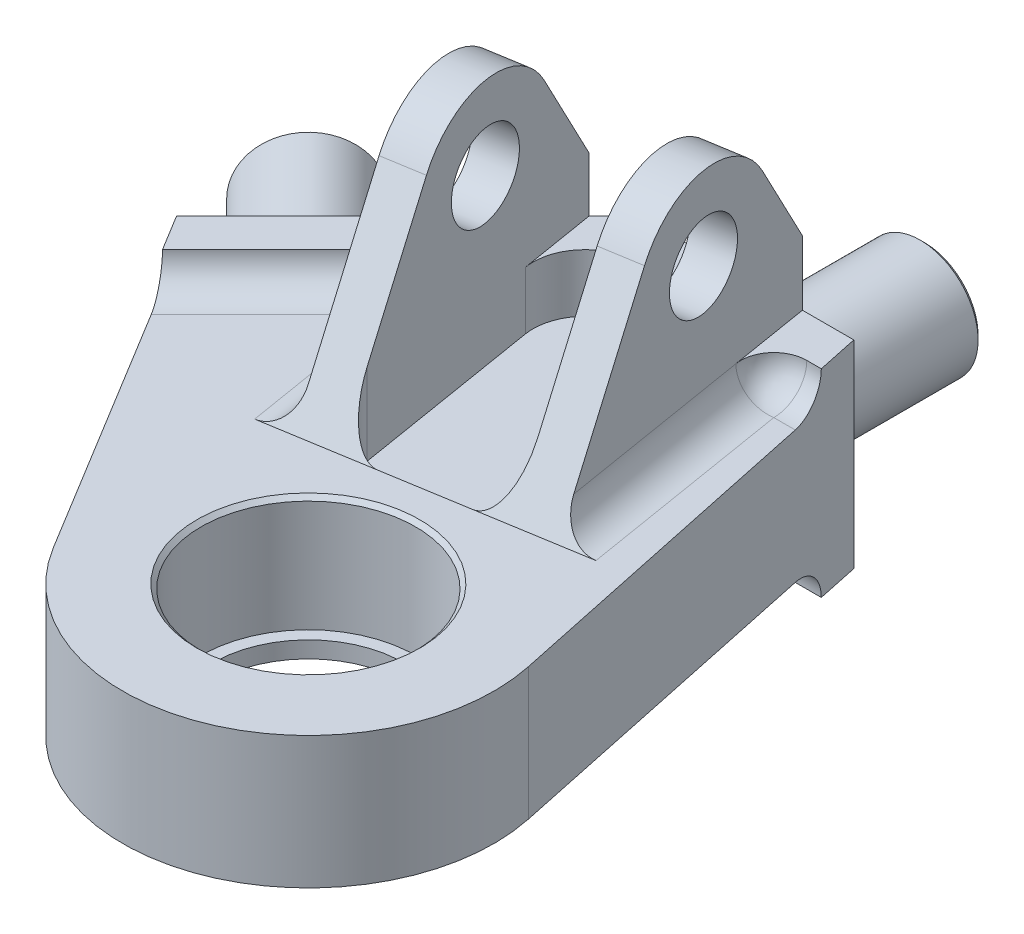
from build123d import *

# Parameters (mm, degrees)
SZKIC1_R                        = 13
SZKIC1_R_2                      = 11.5
DODANIE_WYCI_GNI_CIE1_DEPTH     = 8
SZKIC2_R                        = 5.0000000000000036
DODANIE_WYCI_GNI_CIE2_DEPTH     = 14
DODANIE_WYCI_GNI_CIE3_DEPTH     = 12
WYTNIJ_WYCI_GNI_CIE1_DEPTH      = 81.41142519817177
WYTNIJ_WYCI_GNI_CIE1_DEPTH_BACK = 6
SZKIC1_3_R                      = 13
SZKIC1_3_R_2                    = 11.5
WYTNIJ_WYCI_GNI_CIE2_DEPTH      = 78.26575763170368
WYTNIJ_WYCI_GNI_CIE2_DEPTH_BACK = 3
WYTNIJ_WYCI_GNI_CIE3_START      = 4
WYTNIJ_WYCI_GNI_CIE3_DEPTH      = 74.265757666648
WYTNIJ_WYCI_GNI_CIE4_DEPTH      = 78.26575763170368
SZKIC4_R                        = 7
DODANIE_WYCI_GNI_CIE4_DEPTH     = 20
SZKIC5_R                        = 7
DODANIE_WYCI_GNI_CIE5_DEPTH     = 20
WYTNIJ_WYCI_GNI_CIE5_DEPTH      = 3
ZAOKR_GLENIE1_R                 = 4
ZAOKR_GLENIE2_R                 = 4
ZAOKR_GLENIE3_R                 = 1
SFAZOWANIE1_SIZE                = 0.5


with BuildPart() as part:
    # Szkic1 → Dodanie-wyciągnięcie1 (new, symmetric)
    # profile 1 of 2: a face of its own
    with BuildSketch(Plane(origin=(0, 0, 0), x_dir=(1, 0, 0), z_dir=(0, 1, 0))):
        with BuildLine():
            Line((-39.9157635445463, 22.238094014882595), (-19.20964530804123, -11.714927534528307))
            ThreePointArc((-19.20964530804123, -11.714927534528307), (8.303589569253562, -20.911728772757726), (22.01344157137967, 4.653857559428904))
            Line((22.01344157137967, 4.653857559428904), (12.499999999999995, 49.6538575594289))
            Line((12.499999999999995, 49.6538575594289), (-12.499999999999995, 49.6538575594289))
            Line((-12.499999999999995, 49.6538575594289), (-39.9157635445463, 22.238094014882595))
        make_face()
        Circle(SZKIC1_R, mode=Mode.SUBTRACT)
    # profile 2 of 2: a face of its own
    with BuildSketch(Plane(origin=(0, 0, 0), x_dir=(1, 0, 0), z_dir=(0, 1, 0))):
        Circle(SZKIC1_R)
        with Locations(Location((0, 0, 0), (0, 0, 270))):
            Circle(SZKIC1_R_2, mode=Mode.SUBTRACT)
    extrude(amount=DODANIE_WYCI_GNI_CIE1_DEPTH, both=True)

    # Szkic2 → Dodanie-wyciągnięcie2 (add, symmetric)
    with BuildSketch(Plane(origin=(0, 0, 0), x_dir=(-0.16204203158770583, 0, -0.9867838567786408), z_dir=(0.9867838567786409, 0, -0.16204203158770586))):
        with BuildLine():
            Line((17.185981887192586, 8), (29.887687809364394, 30.00000000000001))
            ThreePointArc((29.887687809364394, 30.00000000000001), (38.54794184720877, 35), (47.20819588505315, 30.000000000000014))
            Line((47.20819588505315, 30.000000000000014), (57.02315046127683, 13.000000000000002))
            Line((57.02315046127683, 13.000000000000002), (57.02315046127683, 8))
            Line((57.02315046127683, 8), (17.185981887192586, 8))
        make_face()
        with Locations((38.54794184720877, 25)):
            Circle(SZKIC2_R, mode=Mode.SUBTRACT)
    extrude(amount=DODANIE_WYCI_GNI_CIE2_DEPTH, both=True)

    # Szkic1<5> → Dodanie-wyciągnięcie3 (add, symmetric)
    with BuildSketch(Plane(origin=(0, 0, 0), x_dir=(1, 0, 0), z_dir=(0, 1, 0))):
        Polygon((-12.499999999999995, 49.6538575594289), (12.499999999999995, 49.6538575594289), (11.442950936513364, 54.6538575594289), (-14.571067811865477, 54.6538575594289), (-42.59444393988905, 26.630481431405318), (-39.9157635445463, 22.238094014882595), align=None)
    extrude(amount=DODANIE_WYCI_GNI_CIE3_DEPTH, both=True)

    # Szkic1<3> → Wytnij-wyciągnięcie1 (cut, two sides: drawn at the far end of the back side and taken through both)
    with BuildSketch(Plane(origin=(0, 0, 0), x_dir=(1, 0, 0), z_dir=(0, 1, 0)).offset(-WYTNIJ_WYCI_GNI_CIE1_DEPTH_BACK)):
        with Locations(Location((0, 0, 0), (0, 0, 270))):
            Circle(SZKIC1_3_R)
        with Locations(Location((0, 0, 0), (0, 0, 270))):
            Circle(SZKIC1_3_R_2, mode=Mode.SUBTRACT)
    extrude(amount=WYTNIJ_WYCI_GNI_CIE1_DEPTH + WYTNIJ_WYCI_GNI_CIE1_DEPTH_BACK, mode=Mode.SUBTRACT)

    # Szkic3 → Wytnij-wyciągnięcie2 (cut, two sides: drawn at the far end of the back side and taken through both)
    with BuildSketch(Plane(origin=(0, 8, 0), x_dir=(1, 0, 0), z_dir=(0, 1, 0)).offset(-WYTNIJ_WYCI_GNI_CIE2_DEPTH_BACK)):
        with BuildLine():
            Line((-16.080898850750692, 42.386356929210905), (-11.665906130837973, 15.500471204882405))
            Line((-11.665906130837973, 15.500471204882405), (6.096203291177561, 18.417227773461114))
            Line((6.096203291177559, 18.417227773461114), (0.9667649489300167, 49.6538575594289))
            Line((0.9667649489300163, 49.6538575594289), (-9.9094763840183, 49.6538575594289))
            ThreePointArc((-9.9094763840183, 49.6538575594289), (-14.676630164659013, 47.44795607994614), (-16.080898850750696, 42.386356929210905))
        make_face()
    extrude(amount=WYTNIJ_WYCI_GNI_CIE2_DEPTH + WYTNIJ_WYCI_GNI_CIE2_DEPTH_BACK, mode=Mode.SUBTRACT)

    # Szkic3<3> → Wytnij-wyciągnięcie3 (cut, through all)
    with BuildSketch(Plane(origin=(0, 8, 0), x_dir=(1, 0, 0), z_dir=(0, 1, 0)).offset(WYTNIJ_WYCI_GNI_CIE3_START)):
        with BuildLine():
            ThreePointArc((-16.080898850750696, 42.386356929210905), (-14.676630164659013, 47.44795607994614), (-9.9094763840183, 49.6538575594289))
            Line((-9.9094763840183, 49.6538575594289), (0.9667649489300167, 49.6538575594289))
            Line((0.9667649489300163, 49.6538575594289), (0.14570352562758648, 54.6538575594289))
            Line((0.14570352562758646, 54.6538575594289), (-14.571067811865477, 54.65385755942889))
            Line((-14.571067811865477, 54.65385755942889), (-17.59826945789091, 51.626655913403454))
            Line((-17.59826945789091, 51.626655913403454), (-16.080898850750696, 42.386356929210905))
        make_face()
    extrude(amount=WYTNIJ_WYCI_GNI_CIE3_DEPTH, mode=Mode.SUBTRACT)

    # Szkic3<4> → Wytnij-wyciągnięcie4 (cut, through all)
    with BuildSketch(Plane(origin=(0, 8, 0), x_dir=(1, 0, 0), z_dir=(0, 1, 0))):
        Polygon((-9.240147148276744, 56.26952433784747), (-8.97483481534258, 54.65385755942888), (0.14570352562758693, 54.6538575594289), (5.212669270611022, 54.6538575594289), (4.5748268466242505, 58.53811278007535), align=None)
        Polygon((-14.571067811865477, 54.65385755942889), (-8.974834815342582, 54.65385755942889), (-9.240147148276744, 56.26952433784747), (-23.055121143177697, 54.00093589561959), (-21.95053906691765, 47.274386304376705), (-17.59826945789091, 51.626655913403454), align=None)
    extrude(amount=WYTNIJ_WYCI_GNI_CIE4_DEPTH, mode=Mode.SUBTRACT)

    # Szkic4 → Dodanie-wyciągnięcie4 (add)
    with BuildSketch(Plane(origin=(0, 0, -54.6538575594289), x_dir=(-1, 0, 0), z_dir=(0, 0, -1))):
        Circle(SZKIC4_R)
    extrude(amount=DODANIE_WYCI_GNI_CIE4_DEPTH)

    # Szkic5 → Dodanie-wyciągnięcie5 (add)
    with BuildSketch(Plane(origin=(-34.6124626856472, 0, -34.61246268564717), x_dir=(-0.7071067811865475, 0, 0.7071067811865477), z_dir=(-0.7071067811865477, 0, -0.7071067811865475))):
        Circle(SZKIC5_R)
    extrude(amount=DODANIE_WYCI_GNI_CIE5_DEPTH)

    # Szkic6 → Wytnij-wyciągnięcie5 (cut)
    with BuildSketch(Plane.XZ.offset(8)):
        Polygon((7.635842149160336, -43.65385755942889), (13.165024277111744, -17.499999999999996), (-7.248737341529154, -17.5), (-21.380397649888803, -3.3683396916403576), (-32.335886609702584, -21.332689575487763), (-10.01471862576144, -43.65385755942889), align=None)
    extrude(amount=-WYTNIJ_WYCI_GNI_CIE5_DEPTH, mode=Mode.SUBTRACT)

    # Zaokrąglenie1
    zaokr_glenie1_edges = [part.edges().sort_by_distance(p)[0] for p in [
        (7.635842149160336, -6.5, -43.65385755942889),
        (-10.01471862576144, -6.5, -43.65385755942889),
        (-32.335886609702584, -6.5, -21.332689575487763),
        (-21.380397649888803, -6.5, -3.3683396916403576),
        (-7.248737341529154, -6.5, -17.5),
        (13.165024277111744, -6.5, -17.499999999999996),
        (-12.499999999999995, -10, -49.6538575594289),
        (6.033730693913451, 10, -49.6538575594289),
        (-20.953164090141588, 10, -41.20069346928731),
        (6.09620329117756, 6.5, -18.417227773461114),
        (0.9667649489300165, 8.5, -49.6538575594289),
        (-11.665906130837973, 6.5, -15.500471204882405),
    ]]
    fillet(zaokr_glenie1_edges, radius=ZAOKR_GLENIE1_R)

    # Zaokrąglenie2
    zaokr_glenie2_edges = [part.edges().sort_by_distance(p)[0] for p in [
        (-18.144884891779377, 8, -24.099176343644537),
        (-22.41182088800963, 8, -36.667644697134236),
        (-33.19063523261732, 8, -28.96322232681158),
        (11.622076214271065, 8, -49.6538575594289),
        (8.91356978824917, 8, -32.11656368223886),
        (7.695163046353066, 8, -48.2430009983481),
        (-26.793668209900048, -8, -35.360189349528845),
        (-12.373879479967972, -8, -49.34937568947405),
        (0.8284271247461916, -8, -49.6538575594289),
    ]]
    fillet(zaokr_glenie2_edges, radius=ZAOKR_GLENIE2_R - 0.0001)  # a hair under: the kernel refuses the full size

    # Zaokrąglenie3
    zaokr_glenie3_edges = [part.edges().sort_by_distance(p)[0] for p in [
        (7, 8.6e-16, -54.6538575594289),
        (-29.66271521734136, 8.6e-16, -39.56221015395302),
    ]]
    fillet(zaokr_glenie3_edges, radius=ZAOKR_GLENIE3_R)

    # Sfazowanie1
    sfazowanie1_edges = [part.edges().sort_by_distance(p)[0] for p in [
        (7, 8.6e-16, -74.6538575594289),
        (-43.804850841072316, 8.6e-16, -53.70434577768397),
        (6.57e-15, 8, -13),
    ]]
    chamfer(sfazowanie1_edges, length=SFAZOWANIE1_SIZE)


solid = part.part
